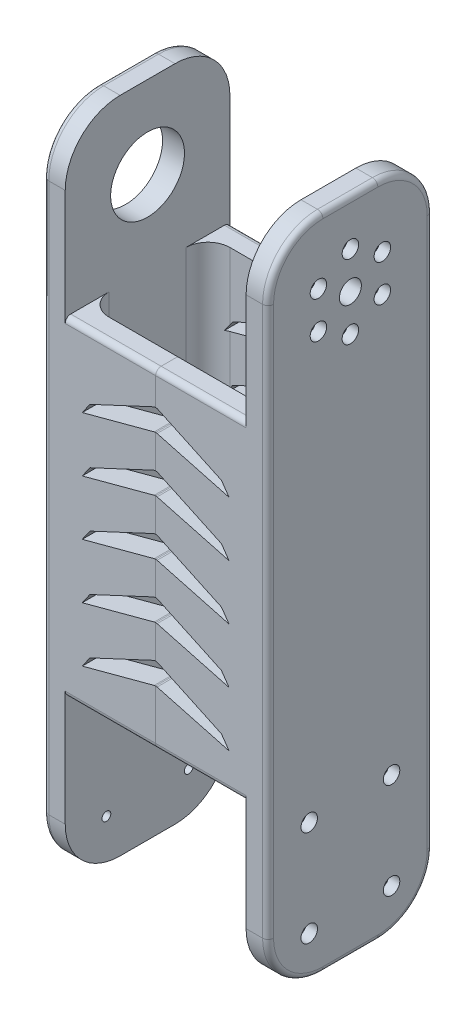
from build123d import *

# Parameters (mm, degrees)
SKETCH_1_W             = 60
SKETCH_1_H             = 240
EXTRUDE_1_DEPTH        = 8
SKETCH_2_R             = 13.45
CUT_EXTRUDE_1_DEPTH    = 124.951603459
SKETCH_3_W             = 8
SKETCH_3_H             = 120
EXTRUDE_2_DEPTH        = 65.9
SKETCH_4_W             = 60
SKETCH_4_H             = 240
EXTRUDE_3_DEPTH        = 8
FILLET_1_R             = 20
CUT_EXTRUDE_2_REACH    = 150.35
SKETCH_10_R            = 4
SKETCH_10_R_2          = 1.6
SKETCH_15_R            = 18
EXTRUDE_4_DEPTH        = 9.8
SKETCH_11_R            = 1.6
CUT_EXTRUDE_3_DEPTH    = 149.349620829
SKETCH_12_R            = 3
CUT_EXTRUDE_4_DEPTH    = 4
SKETCH_13_R            = 3
CUT_EXTRUDE_5_DEPTH    = 4
CUT_EXTRUDE_START      = -4
SKETCH_14_R            = 3
CUT_EXTRUDE_6_DEPTH    = 4
CUT_EXTRUDE_7_REACH    = 150.35
SKETCH_10_2_R          = 4
SKETCH_10_2_R_2        = 1.6
FILLET_2_R             = 8
FILLET_3_R             = 2
CUT_EXTRUDE_8_DEPTH    = 158.18654534
PATTERN_LINEAR_1_COUNT = 5
PATTERN_LINEAR_1_PITCH = 20


with BuildPart() as part:
    # 草图1 → 凸台-拉伸1 (new body)
    with BuildSketch(Plane(origin=(0, 0, 0), x_dir=(0, 0, -1), z_dir=(1, 0, 0))):
        Rectangle(SKETCH_1_W, SKETCH_1_H)
    extrude(amount=EXTRUDE_1_DEPTH)

    # 草图2 → 切除-拉伸1 (cut, through all)
    with BuildSketch(Plane(origin=(8, 0, 0), x_dir=(0, 0, -1), z_dir=(1, 0, 0))):
        with Locations((0, 90)):
            Circle(SKETCH_2_R)
    extrude(amount=-CUT_EXTRUDE_1_DEPTH, mode=Mode.SUBTRACT)

    # 草图3 → 凸台-拉伸2 (add)
    with BuildSketch(Plane(origin=(8, 0, 0), x_dir=(0, 0, -1), z_dir=(1, 0, 0))):
        with Locations((-26, 0)):
            Rectangle(SKETCH_3_W, SKETCH_3_H)
        with Locations((26, 0)):
            Rectangle(SKETCH_3_W, SKETCH_3_H)
    extrude(amount=EXTRUDE_2_DEPTH)

    # 草图4 → 凸台-拉伸3 (add)
    with BuildSketch(Plane(origin=(73.9, 0, 0), x_dir=(0, 0, -1), z_dir=(1, 0, 0))):
        Rectangle(SKETCH_4_W, SKETCH_4_H)
    extrude(amount=EXTRUDE_3_DEPTH)

    # 圆角1
    fillet_1_edges = [part.edges().sort_by_distance(p)[0] for p in [
        (4, -120, 30),
        (4, -120, -30),
        (4, 120, -30),
        (4, 120, 30),
        (77.9, 120, -30),
        (77.9, 120, 30),
        (77.9, -120, -30),
        (77.9, -120, 30),
    ]]
    fillet(fillet_1_edges, radius=FILLET_1_R)

    # 草图10 → 切除-拉伸2 (cut, up to next)
    with BuildSketch(Plane(origin=(81.9, 0, 0), x_dir=(0, 0, -1), z_dir=(1, 0, 0)), mode=Mode.PRIVATE) as cut_extrude_2_sk1:
        with Locations((0, 90)):
            Circle(SKETCH_10_R)
    cut_extrude_2_tool1 = extrude(cut_extrude_2_sk1.sketch, amount=-CUT_EXTRUDE_2_REACH, mode=Mode.PRIVATE) & part.part
    # 草图10 → 切除-拉伸2 (cut, up to next)
    with BuildSketch(Plane(origin=(81.9, 0, 0), x_dir=(0, 0, -1), z_dir=(1, 0, 0)), mode=Mode.PRIVATE) as cut_extrude_2_sk2:
        with Locations((0, 103.5)):
            Circle(SKETCH_10_R_2)
    cut_extrude_2_tool2 = extrude(cut_extrude_2_sk2.sketch, amount=-CUT_EXTRUDE_2_REACH, mode=Mode.PRIVATE) & part.part
    # 草图10 → 切除-拉伸2 (cut, up to next)
    with BuildSketch(Plane(origin=(81.9, 0, 0), x_dir=(0, 0, -1), z_dir=(1, 0, 0)), mode=Mode.PRIVATE) as cut_extrude_2_sk3:
        with Locations((11.691342951, 96.75)):
            Circle(SKETCH_10_R_2)
    cut_extrude_2_tool3 = extrude(cut_extrude_2_sk3.sketch, amount=-CUT_EXTRUDE_2_REACH, mode=Mode.PRIVATE) & part.part
    # 草图10 → 切除-拉伸2 (cut, up to next)
    with BuildSketch(Plane(origin=(81.9, 0, 0), x_dir=(0, 0, -1), z_dir=(1, 0, 0)), mode=Mode.PRIVATE) as cut_extrude_2_sk4:
        with Locations((11.691342951, 83.25)):
            Circle(SKETCH_10_R_2)
    cut_extrude_2_tool4 = extrude(cut_extrude_2_sk4.sketch, amount=-CUT_EXTRUDE_2_REACH, mode=Mode.PRIVATE) & part.part
    # 草图10 → 切除-拉伸2 (cut, up to next)
    with BuildSketch(Plane(origin=(81.9, 0, 0), x_dir=(0, 0, -1), z_dir=(1, 0, 0)), mode=Mode.PRIVATE) as cut_extrude_2_sk5:
        with Locations((0, 76.5)):
            Circle(SKETCH_10_R_2)
    cut_extrude_2_tool5 = extrude(cut_extrude_2_sk5.sketch, amount=-CUT_EXTRUDE_2_REACH, mode=Mode.PRIVATE) & part.part
    # 草图10 → 切除-拉伸2 (cut, up to next)
    with BuildSketch(Plane(origin=(81.9, 0, 0), x_dir=(0, 0, -1), z_dir=(1, 0, 0)), mode=Mode.PRIVATE) as cut_extrude_2_sk6:
        with Locations((-11.691342951, 83.25)):
            Circle(SKETCH_10_R_2)
    cut_extrude_2_tool6 = extrude(cut_extrude_2_sk6.sketch, amount=-CUT_EXTRUDE_2_REACH, mode=Mode.PRIVATE) & part.part
    # 草图10 → 切除-拉伸2 (cut, up to next)
    with BuildSketch(Plane(origin=(81.9, 0, 0), x_dir=(0, 0, -1), z_dir=(1, 0, 0)), mode=Mode.PRIVATE) as cut_extrude_2_sk7:
        with Locations((-11.691342951, 96.75)):
            Circle(SKETCH_10_R_2)
    cut_extrude_2_tool7 = extrude(cut_extrude_2_sk7.sketch, amount=-CUT_EXTRUDE_2_REACH, mode=Mode.PRIVATE) & part.part
    add(cut_extrude_2_tool1.solids().sort_by_distance((81.9, 90, 0))[0], mode=Mode.SUBTRACT)
    add(cut_extrude_2_tool2.solids().sort_by_distance((81.9, 103.5, 0))[0], mode=Mode.SUBTRACT)
    add(cut_extrude_2_tool3.solids().sort_by_distance((81.9, 96.75, -11.691343))[0], mode=Mode.SUBTRACT)
    add(cut_extrude_2_tool4.solids().sort_by_distance((81.9, 83.25, -11.691343))[0], mode=Mode.SUBTRACT)
    add(cut_extrude_2_tool5.solids().sort_by_distance((81.9, 76.5, 0))[0], mode=Mode.SUBTRACT)
    add(cut_extrude_2_tool6.solids().sort_by_distance((81.9, 83.25, 11.691343))[0], mode=Mode.SUBTRACT)
    add(cut_extrude_2_tool7.solids().sort_by_distance((81.9, 96.75, 11.691343))[0], mode=Mode.SUBTRACT)

    # 草图15 → 凸台-拉伸4 (add)
    with BuildSketch(Plane.ZY.offset(-73.9)):
        with Locations((0, 90)):
            Circle(SKETCH_15_R)
    extrude(amount=EXTRUDE_4_DEPTH)

    # 草图11 → 切除-拉伸3 (cut, through all)
    with BuildSketch(Plane(origin=(81.9, 0, 0), x_dir=(0, 0, -1), z_dir=(1, 0, 0))):
        with Locations((-15, -70)):
            Circle(SKETCH_11_R)
        with Locations((15, -70)):
            Circle(SKETCH_11_R)
        with Locations((15, -105)):
            Circle(SKETCH_11_R)
        with Locations((-15, -105)):
            Circle(SKETCH_11_R)
    extrude(amount=-CUT_EXTRUDE_3_DEPTH, mode=Mode.SUBTRACT)

    # 草图12 → 切除-拉伸4 (cut)
    with BuildSketch(Plane(origin=(81.9, 0, 0), x_dir=(0, 0, -1), z_dir=(1, 0, 0))):
        with Locations((0, 103.45)):
            Circle(SKETCH_12_R)
        with Locations((11.648041681, 96.725)):
            Circle(SKETCH_12_R)
        with Locations((11.648041681, 83.275)):
            Circle(SKETCH_12_R)
        with Locations((0, 76.55)):
            Circle(SKETCH_12_R)
        with Locations((-11.648041681, 83.275)):
            Circle(SKETCH_12_R)
        with Locations((-11.648041681, 96.725)):
            Circle(SKETCH_12_R)
    extrude(amount=-CUT_EXTRUDE_4_DEPTH, mode=Mode.SUBTRACT)

    # 草图13 → 切除-拉伸5 (cut)
    with BuildSketch(Plane(origin=(81.9, 0, 0), x_dir=(0, 0, -1), z_dir=(1, 0, 0))):
        with Locations((-15, -70)):
            Circle(SKETCH_13_R)
        with Locations((15, -70)):
            Circle(SKETCH_13_R)
        with Locations((15, -105)):
            Circle(SKETCH_13_R)
        with Locations((-15, -105)):
            Circle(SKETCH_13_R)
    extrude(amount=-CUT_EXTRUDE_5_DEPTH, mode=Mode.SUBTRACT)

    # 草图14 → 切除-拉伸6 (cut)
    with BuildSketch(Plane.ZY.offset(CUT_EXTRUDE_START)):
        with Locations((-15, -70)):
            Circle(SKETCH_14_R)
        with Locations((15, -70)):
            Circle(SKETCH_14_R)
        with Locations((15, -105)):
            Circle(SKETCH_14_R)
        with Locations((-15, -105)):
            Circle(SKETCH_14_R)
    extrude(amount=CUT_EXTRUDE_6_DEPTH, mode=Mode.SUBTRACT)

    # 草图10<2> → 切除-拉伸7 (cut, up to next)
    with BuildSketch(Plane(origin=(81.9, 0, 0), x_dir=(0, 0, -1), z_dir=(1, 0, 0)), mode=Mode.PRIVATE) as cut_extrude_7_sk1:
        with Locations((0, 90)):
            Circle(SKETCH_10_2_R)
    cut_extrude_7_tool1 = extrude(cut_extrude_7_sk1.sketch, amount=-CUT_EXTRUDE_7_REACH, mode=Mode.PRIVATE) & part.part
    # 草图10<2> → 切除-拉伸7 (cut, up to next)
    with BuildSketch(Plane(origin=(81.9, 0, 0), x_dir=(0, 0, -1), z_dir=(1, 0, 0)), mode=Mode.PRIVATE) as cut_extrude_7_sk2:
        with Locations((0, 103.5)):
            Circle(SKETCH_10_2_R_2)
    cut_extrude_7_tool2 = extrude(cut_extrude_7_sk2.sketch, amount=-CUT_EXTRUDE_7_REACH, mode=Mode.PRIVATE) & part.part
    # 草图10<2> → 切除-拉伸7 (cut, up to next)
    with BuildSketch(Plane(origin=(81.9, 0, 0), x_dir=(0, 0, -1), z_dir=(1, 0, 0)), mode=Mode.PRIVATE) as cut_extrude_7_sk3:
        with Locations((11.691342951, 96.75)):
            Circle(SKETCH_10_2_R_2)
    cut_extrude_7_tool3 = extrude(cut_extrude_7_sk3.sketch, amount=-CUT_EXTRUDE_7_REACH, mode=Mode.PRIVATE) & part.part
    # 草图10<2> → 切除-拉伸7 (cut, up to next)
    with BuildSketch(Plane(origin=(81.9, 0, 0), x_dir=(0, 0, -1), z_dir=(1, 0, 0)), mode=Mode.PRIVATE) as cut_extrude_7_sk4:
        with Locations((11.691342951, 83.25)):
            Circle(SKETCH_10_2_R_2)
    cut_extrude_7_tool4 = extrude(cut_extrude_7_sk4.sketch, amount=-CUT_EXTRUDE_7_REACH, mode=Mode.PRIVATE) & part.part
    # 草图10<2> → 切除-拉伸7 (cut, up to next)
    with BuildSketch(Plane(origin=(81.9, 0, 0), x_dir=(0, 0, -1), z_dir=(1, 0, 0)), mode=Mode.PRIVATE) as cut_extrude_7_sk5:
        with Locations((0, 76.5)):
            Circle(SKETCH_10_2_R_2)
    cut_extrude_7_tool5 = extrude(cut_extrude_7_sk5.sketch, amount=-CUT_EXTRUDE_7_REACH, mode=Mode.PRIVATE) & part.part
    # 草图10<2> → 切除-拉伸7 (cut, up to next)
    with BuildSketch(Plane(origin=(81.9, 0, 0), x_dir=(0, 0, -1), z_dir=(1, 0, 0)), mode=Mode.PRIVATE) as cut_extrude_7_sk6:
        with Locations((-11.691342951, 83.25)):
            Circle(SKETCH_10_2_R_2)
    cut_extrude_7_tool6 = extrude(cut_extrude_7_sk6.sketch, amount=-CUT_EXTRUDE_7_REACH, mode=Mode.PRIVATE) & part.part
    # 草图10<2> → 切除-拉伸7 (cut, up to next)
    with BuildSketch(Plane(origin=(81.9, 0, 0), x_dir=(0, 0, -1), z_dir=(1, 0, 0)), mode=Mode.PRIVATE) as cut_extrude_7_sk7:
        with Locations((-11.691342951, 96.75)):
            Circle(SKETCH_10_2_R_2)
    cut_extrude_7_tool7 = extrude(cut_extrude_7_sk7.sketch, amount=-CUT_EXTRUDE_7_REACH, mode=Mode.PRIVATE) & part.part
    add(cut_extrude_7_tool1.solids().sort_by_distance((81.9, 90, 0))[0], mode=Mode.SUBTRACT)
    add(cut_extrude_7_tool2.solids().sort_by_distance((81.9, 103.5, 0))[0], mode=Mode.SUBTRACT)
    add(cut_extrude_7_tool3.solids().sort_by_distance((81.9, 96.75, -11.691343))[0], mode=Mode.SUBTRACT)
    add(cut_extrude_7_tool4.solids().sort_by_distance((81.9, 83.25, -11.691343))[0], mode=Mode.SUBTRACT)
    add(cut_extrude_7_tool5.solids().sort_by_distance((81.9, 76.5, 0))[0], mode=Mode.SUBTRACT)
    add(cut_extrude_7_tool6.solids().sort_by_distance((81.9, 83.25, 11.691343))[0], mode=Mode.SUBTRACT)
    add(cut_extrude_7_tool7.solids().sort_by_distance((81.9, 96.75, 11.691343))[0], mode=Mode.SUBTRACT)

    # 圆角2
    fillet_2_edges = [part.edges().sort_by_distance(p)[0] for p in [
        (8, 0, -22),
        (73.9, 0, -22),
        (8, 0, 22),
        (73.9, 0, 22),
    ]]
    fillet(fillet_2_edges, radius=FILLET_2_R)

    # 圆角3
    fillet_3_edges = [part.edges().sort_by_distance(p)[0] for p in [
        (40.95, -60, 30),
        (40.95, -60, -30),
        (40.95, 60, 30),
        (40.95, 60, -30),
        (0, -114.142135624, -24.142135624),
        (0, -120, 0),
        (0, -114.142135624, 24.142135624),
        (0, 0, 30),
        (0, 114.142135624, 24.142135624),
        (0, 120, 0),
        (0, 114.142135624, -24.142135624),
        (81.9, -114.142135624, -24.142135624),
        (81.9, -120, 0),
        (81.9, -114.142135624, 24.142135624),
        (81.9, 0, 30),
        (81.9, 114.142135624, 24.142135624),
        (81.9, 120, 0),
        (81.9, 114.142135624, -24.142135624),
        (0, 0, -30),
        (81.9, 0, -30),
    ]]
    fillet(fillet_3_edges, radius=FILLET_3_R)

    # 草图16 → 切除-拉伸8 (cut, through all)
    with BuildSketch(Plane(origin=(0, 0, -30), x_dir=(-1, 0, 0), z_dir=(0, 0, -1))):
        with BuildLine():
            Line((-41.795236523, -32.226071851), (-64.9, -43))
            Line((-64.9, -43), (-67.701595509, -47))
            Line((-67.701595509, -47), (-41.46763809, -39.970632295))
            ThreePointArc((-41.46763809, -39.970632295), (-40.95, -39.902483948), (-40.43236191, -39.970632295))
            Line((-40.43236191, -39.970632295), (-14.198404491, -47))
            Line((-14.198404491, -47), (-17, -43))
            Line((-17, -43), (-40.104763477, -32.226071851))
            ThreePointArc((-40.104763477, -32.226071851), (-40.95, -32.038687425), (-41.795236523, -32.226071851))
        make_face()
    cut_extrude_8 = extrude(amount=-CUT_EXTRUDE_8_DEPTH, mode=Mode.SUBTRACT)

    # 阵列(线性)1: 切除-拉伸8 ×5
    with Locations(*[(0, i * PATTERN_LINEAR_1_PITCH, 0) for i in range(1, PATTERN_LINEAR_1_COUNT)]):
        add(cut_extrude_8, mode=Mode.SUBTRACT)


with BuildPart() as body_2:
    # Split Bodies 1: the piece on the far side of the plane
    add(part.part)
    split(bisect_by=Plane(origin=(40.95, 0, 0), x_dir=(0, 0, 1), z_dir=(1, 0, 0)), keep=Keep.BOTTOM)


with BuildPart() as part_1:
    add(part.part)

    # Split Bodies 1
    split(bisect_by=Plane(origin=(40.95, 0, 0), x_dir=(0, 0, 1), z_dir=(1, 0, 0)), keep=Keep.TOP)


solid = Compound([body_2.part, part_1.part])
